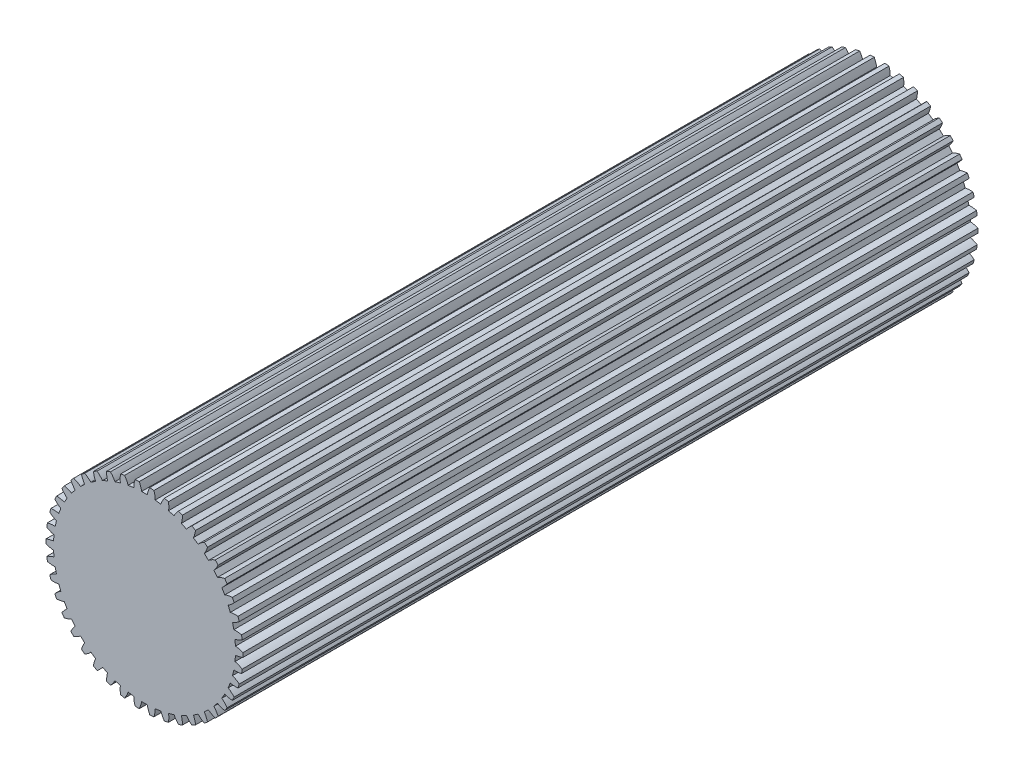
from build123d import *

# Parameters (mm, degrees)
SKETCH1_R           = 18.626666667
BOSS_EXTRUDE1_DEPTH = 139
CUT_EXTRUDE2_DEPTH  = 140
CIRPATTERN1_COUNT   = 42


with BuildPart() as part:
    # Sketch1 → Boss-Extrude1 (new body)
    with BuildSketch(Plane.XY):
        Circle(SKETCH1_R)
    extrude(amount=BOSS_EXTRUDE1_DEPTH)

    # Sketch2 → Cut-Extrude2 (cut, symmetric)
    with BuildSketch(Plane.XY):
        with BuildLine():
            add(Edge.make_bspline(
                [(17.197794317, 0.739009432), (17.203892696, 0.739218074), (17.21543595, 0.73930356), (17.234290481, 0.73910886), (17.271535049, 0.737867759), (17.313692039, 0.735293434), (17.361379443, 0.731228124), (17.412709302, 0.725698856), (17.45664549, 0.720250412), (17.500520881, 0.714143297), (17.54427023, 0.70745302), (17.597315869, 0.698630803), (17.66099398, 0.687053386), (17.735530693, 0.672062459), (17.820194333, 0.653336786), (17.906624473, 0.632403089), (17.991790805, 0.610283496), (18.077983339, 0.586179627), (18.161481204, 0.561614407), (18.248366585, 0.534292881), (18.328644137, 0.508156476), (18.418766174, 0.476867684), (18.491547283, 0.451032541), (18.566887923, 0.422665763), (18.603580461, 0.408611376), (18.622342766, 0.401324063)],
                knots=[0, 0, 0, 0, 0, 0.015083688, 0.02853182, 0.04661014, 0.092110526, 0.119476176, 0.146842496, 0.174208854, 0.201574956, 0.228941013, 0.256307345, 0.307035032, 0.361767352, 0.416499661, 0.471231937, 0.525964282, 0.580696616, 0.635428982, 0.690161387, 0.744893688, 0.799626082, 0.854358407, 0.909090914, 0.909090914, 0.909090914, 0.909090914, 0.909090914], degree=4))
            Line((18.622342766, 0.401324063), (59.986071903, 1.29274036))
            add(Edge.make_bspline(
                [(59.986071903, 1.29274036), (59.984705998, 1.356121459), (59.981788512, 1.47956213), (59.973929675, 1.790524821), (59.96571531, 2.028377944), (59.95367575, 2.372260269), (59.94146295, 2.652288961), (59.926888549, 2.970752343), (59.911256555, 3.265919581), (59.893811207, 3.574911958), (59.874955933, 3.875648951), (59.85453816, 4.180793709), (59.83250074, 4.483826067), (59.809127391, 4.786758311), (59.783837648, 5.091537965), (59.757659801, 5.391726207), (59.728857375, 5.699867489), (59.700322379, 5.99406778), (59.667269491, 6.311146391), (59.637609774, 6.589867618), (59.598261861, 6.931703464), (59.570934309, 7.168124252), (59.532358786, 7.476785046), (59.516845808, 7.599281815), (59.508749995, 7.662158578)],
                knots=[0.083333333, 0.083333333, 0.083333333, 0.083333333, 0.083333333, 0.123015873, 0.162698413, 0.202380952, 0.242063492, 0.281746032, 0.321428571, 0.361111111, 0.400793651, 0.44047619, 0.48015873, 0.51984127, 0.55952381, 0.599206349, 0.638888889, 0.678571429, 0.718253968, 0.757936508, 0.797619048, 0.837301587, 0.876984127, 0.916666667, 0.916666667, 0.916666667, 0.916666667, 0.916666667], degree=4))
            Line((59.508749995, 7.662158578), (18.474160832, 2.378674563))
            add(Edge.make_bspline(
                [(17.115852804, 1.832442931), (17.121914166, 1.833145535), (17.133341232, 1.834781437), (17.151956155, 1.837784085), (17.188599755, 1.844562338), (17.229902204, 1.853391084), (17.276451075, 1.864518426), (17.326383528, 1.877636255), (17.369016937, 1.889572194), (17.411492058, 1.902150385), (17.453755628, 1.915286439), (17.504893908, 1.931916162), (17.566135263, 1.952854998), (17.63760518, 1.978787609), (17.718532281, 2.009922593), (17.800877062, 2.043504222), (17.881795402, 2.07807014), (17.963432742, 2.11475112), (18.042336749, 2.151486678), (18.124179629, 2.191452639), (18.199665119, 2.22926187), (18.284117214, 2.273633185), (18.35223489, 2.310027232), (18.422506189, 2.349306116), (18.456694203, 2.368672266), (18.474160832, 2.378674563)],
                knots=[0, 0, 0, 0, 0, 0.015083688, 0.02853182, 0.04661014, 0.092110526, 0.119476176, 0.146842496, 0.174208854, 0.201574956, 0.228941013, 0.256307345, 0.307035032, 0.361767352, 0.416499661, 0.471231937, 0.525964282, 0.580696616, 0.635428982, 0.690161387, 0.744893688, 0.799626082, 0.854358407, 0.909090914, 0.909090914, 0.909090914, 0.909090914, 0.909090914], degree=4))
            Line((17.115852804, 1.832442931), (17.197794317, 0.739009432))
        make_face()
    cut_extrude2 = extrude(amount=CUT_EXTRUDE2_DEPTH, both=True, mode=Mode.SUBTRACT)

    # CirPattern1: Cut-Extrude2 ×42 about axis
    cirpattern1_axis = Axis((0, 0, -6.95), (0, 0, 1))
    for i in range(1, CIRPATTERN1_COUNT):
        add(cut_extrude2.rotate(cirpattern1_axis, i * 360 / CIRPATTERN1_COUNT), mode=Mode.SUBTRACT)


solid = part.part
